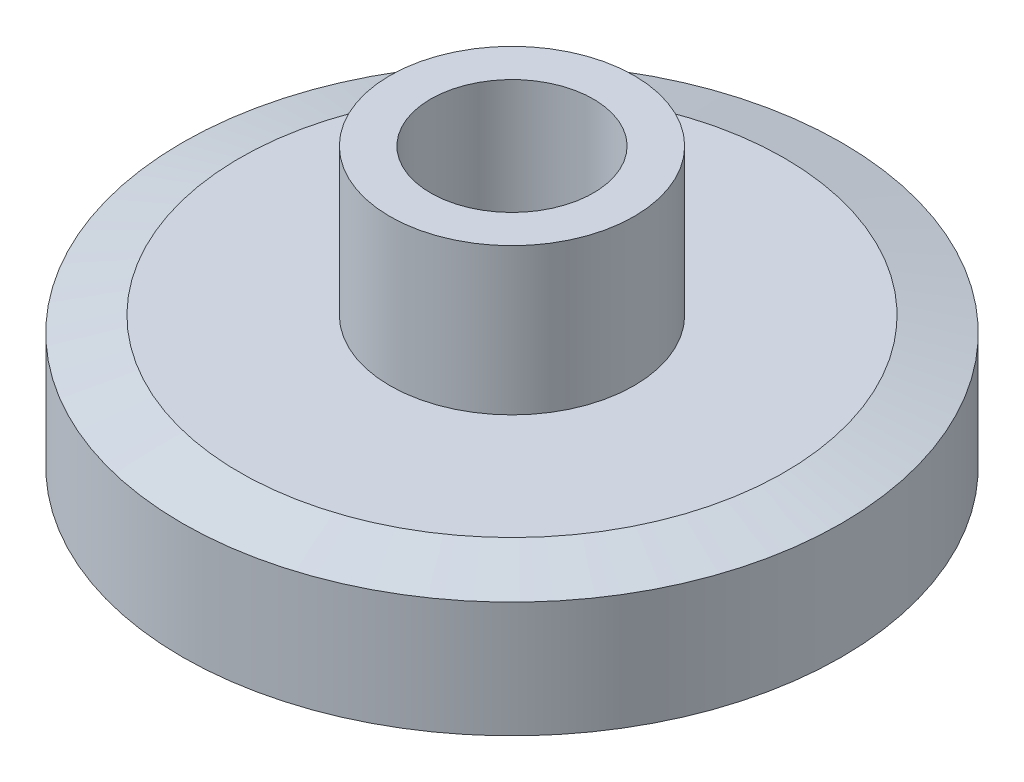
from build123d import *

# Parameters (mm, degrees)
CHAMFER_2_SIZE           = 1.41
CHAMFER_2_SIZE2          = 0.377808361
CHAMFER_3_SIZE           = 1.41
CHAMFER_3_SIZE2          = 0.377808361
CUT_EXTRUDE_2_DEPTH      = 14.529966741
CUT_EXTRUDE_2_DEPTH_BACK = 14.529966741
SKETCH_4_R               = 2


with BuildPart() as part:
    # Эскиз2 → Повернуть2 (revolve)
    with BuildSketch(Plane.XY):
        Polygon((0, 0), (8.1, 0), (8.1, 3.6), (3, 3.6), (3, 7.2), (0, 7.2), align=None)
    revolve(axis=Axis((0, 7.2, 0), (0, -1, 0)))

    # Фаска2
    chamfer_2_edges = [part.edges().sort_by_distance(p)[0] for p in [
        (-8.1, 3.6, 0),
    ]]
    chamfer_2_side = [part.faces().sort_by_distance(p)[0] for p in [
        (-7.870897403, 3.6, 0),
    ]]
    chamfer(chamfer_2_edges, length=CHAMFER_2_SIZE, length2=CHAMFER_2_SIZE2, reference=chamfer_2_side[0])

    # Фаска3
    chamfer_3_edges = [part.edges().sort_by_distance(p)[0] for p in [
        (-8.1, 0, 0),
    ]]
    chamfer_3_side = [part.faces().sort_by_distance(p)[0] for p in [
        (0, 0, 0),
    ]]
    chamfer(chamfer_3_edges, length=CHAMFER_3_SIZE, length2=CHAMFER_3_SIZE2, reference=chamfer_3_side[0])

    # Эскиз4 → Вырез-Вытянуть2 (cut, two sides: drawn at the far end of the back side and taken through both)
    with BuildSketch(Plane(origin=(0, 7.2, 0), x_dir=(1, 0, 0), z_dir=(0, 1, 0)).offset(-CUT_EXTRUDE_2_DEPTH_BACK)):
        Circle(SKETCH_4_R)
    extrude(amount=CUT_EXTRUDE_2_DEPTH + CUT_EXTRUDE_2_DEPTH_BACK, mode=Mode.SUBTRACT)


solid = part.part
